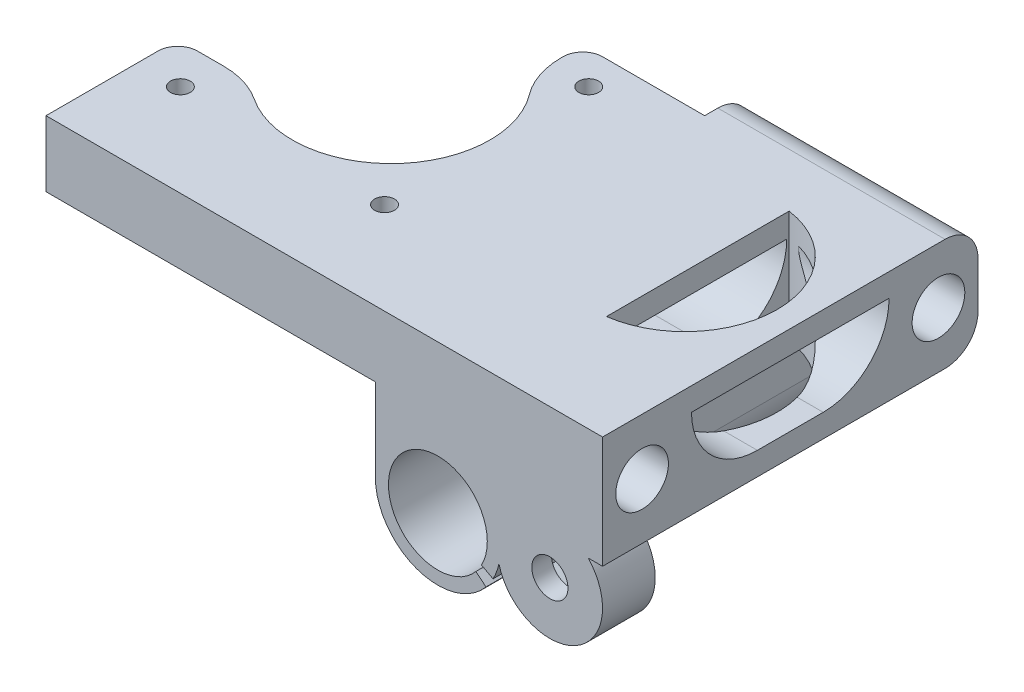
from build123d import *

# Parameters (mm, degrees)
EXTRUDE1_DEPTH  = 57
SKETCH2_R       = 2.75
EXTRUDE2_DEPTH  = 8
EXTRUDE3_DEPTH  = 5
EXTRUDE4_DEPTH  = 50
SKETCH5_R       = 4
EXTRUDE5_DEPTH  = 33
SKETCH6_W       = 30
SKETCH6_H       = 10
EXTRUDE6_DEPTH  = 33
SKETCH7_W       = 50
SKETCH7_H       = 10
EXTRUDE7_DEPTH  = 50
SKETCH10_R      = 1.5
EXTRUDE10_DEPTH = 10
SKETCH11_R      = 2.75
EXTRUDE13_DEPTH = 1
SKETCH12_R      = 15
EXTRUDE14_DEPTH = 10
FILLET2_R       = 5
FILLET3_R       = 5
FILLET4_R       = 10
EXTRUDE15_REACH = 96.553
SKETCH14_W      = 20
SKETCH14_H      = 10
EXTRUDE16_DEPTH = 60
EXTRUDE18_DEPTH = 60
FILLET5_R       = 10
FILLET6_R       = 12
FILLET7_R       = 3
FILLET8_R       = 3
FILLET9_R       = 3


# Some blends are built 0.0001 mm under size
with BuildPart() as part:
    # Sketch1 → Extrude1 (new body)
    with BuildSketch(Plane.XY):
        with BuildLine():
            Line((73.499997202, -17), (73.499997202, 0))
            Line((73.499997202, 0), (39, 0))
            Line((39, 0), (39, -17))
            Line((39, -17), (43.389340395, -17))
            ThreePointArc((43.389340395, -17), (48.49587093, -14.994566191), (53.602401465, -17))
            Line((53.602401465, -17), (73.499997202, -17))
        make_face()
    extrude(amount=-EXTRUDE1_DEPTH)

    # Sketch2 → Extrude2 (add)
    with BuildSketch(Plane.XY):
        with BuildLine():
            Line((57.95839, -23.293955), (57.95839, -17))
            Line((57.95839, -17), (71.309471167, -17))
            ThreePointArc((71.309471167, -17), (69.395977388, -29.48722516), (57.767354943, -24.550891432))
            ThreePointArc((57.767354943, -24.550891432), (57.883931975, -23.925623937), (57.95839, -23.293955))
        make_face()
        with Locations((65.5, -22.5)):
            Circle(SKETCH2_R, mode=Mode.SUBTRACT)
    extrude(amount=-EXTRUDE2_DEPTH)

    # Sketch3 → Extrude3 (cut)
    with BuildSketch(Plane(origin=(0, 0, -8), x_dir=(-1, 0, 0), z_dir=(0, 0, -1))):
        Polygon((-69.5, -20.190598923), (-65.5, -17.881197846), (-61.5, -20.190598923), (-61.5, -24.809401077), (-65.5, -27.118802154), (-69.5, -24.809401077), align=None)
    extrude(amount=-EXTRUDE3_DEPTH, mode=Mode.SUBTRACT)

    # Sketch4 → Extrude4 (add)
    with BuildSketch(Plane.XY):
        with BuildLine():
            Line((39, -17), (39, -22.5))
            ThreePointArc((39, -22.5), (45.271742795, -31.43055539), (55.801591252, -28.564919557))
            Line((55.801591252, -28.564919557), (54.269524764, -27.292339419))
            ThreePointArc((54.269524764, -27.292339419), (43.338902241, -27.950290613), (43.389340395, -17))
            Line((43.389340395, -17), (39, -17))
        make_face()
        with BuildLine():
            Line((56.876362299, -26.964085637), (55.118731957, -26.027376827))
            ThreePointArc((55.118731957, -26.027376827), (55.896414133, -21.25571178), (53.602401465, -17))
            Line((53.602401465, -17), (57.95839, -17))
            Line((57.95839, -17), (57.95839, -23.293955))
            ThreePointArc((57.95839, -23.293955), (57.60414849, -25.184084529), (56.876362299, -26.964085637))
        make_face()
    extrude(amount=-EXTRUDE4_DEPTH)

    # Sketch5 → Extrude5 (cut)
    with BuildSketch(Plane(origin=(73.499997202, 0, 0), x_dir=(0, 0, -1), z_dir=(1, 0, 0))):
        with Locations((6, -8.5)):
            Circle(SKETCH5_R)
        with Locations((51, -8.5)):
            Circle(SKETCH5_R)
    extrude(amount=-EXTRUDE5_DEPTH, mode=Mode.SUBTRACT)

    # Sketch6 → Extrude6 (cut)
    with BuildSketch(Plane(origin=(73.499997202, 0, 0), x_dir=(0, 0, -1), z_dir=(1, 0, 0))):
        with Locations((28.5, -8.5)):
            Rectangle(SKETCH6_W, SKETCH6_H)
    extrude(amount=-EXTRUDE6_DEPTH, mode=Mode.SUBTRACT)

    # Sketch7 → Extrude7 (add)
    with BuildSketch(Plane.ZY.offset(-39)):
        with Locations((-25, -5)):
            Rectangle(SKETCH7_W, SKETCH7_H)
    extrude(amount=EXTRUDE7_DEPTH)

    # Sketch10 → Extrude10 (cut)
    with BuildSketch(Plane.XZ.offset(10)):
        with Locations((-4.599204374, -45)):
            Circle(SKETCH10_R)
        with Locations((26.400795626, -45)):
            Circle(SKETCH10_R)
        with Locations((26.400795626, -14)):
            Circle(SKETCH10_R)
        with Locations((-4.599204374, -14)):
            Circle(SKETCH10_R)
    extrude(amount=-EXTRUDE10_DEPTH, mode=Mode.SUBTRACT)

    # Sketch11 → Extrude13 (cut)
    with BuildSketch(Plane.XZ.offset(10)):
        with Locations((-4.599204374, -14)):
            Circle(SKETCH11_R)
        with Locations((26.400795626, -14)):
            Circle(SKETCH11_R)
        with Locations((26.400795626, -45)):
            Circle(SKETCH11_R)
    extrude(amount=-EXTRUDE13_DEPTH, mode=Mode.SUBTRACT)

    # Sketch12 → Extrude14 (cut)
    with BuildSketch(Plane.XZ.offset(10)):
        with Locations((10.900795626, -30.5)):
            Circle(SKETCH12_R)
    extrude(amount=-EXTRUDE14_DEPTH, mode=Mode.SUBTRACT)

    # Fillet2
    fillet2_edges = [part.edges().sort_by_distance(p)[0] for p in [
        (48.49587093, -14.994566191, -57),
        (63.551199334, -17, -57),
        (41.194670197, -17, -57),
    ]]
    fillet(fillet2_edges, radius=FILLET2_R)

    # Fillet3
    fillet3_edges = [part.edges().sort_by_distance(p)[0] for p in [
        (56.249998601, 0, -57),
    ]]
    fillet(fillet3_edges, radius=FILLET3_R)

    # Fillet4
    fillet4_edges = [part.edges().sort_by_distance(p)[0] for p in [
        (56.999997202, -13.5, -43.5),
    ]]
    fillet(fillet4_edges, radius=FILLET4_R - 0.0001)  # a hair under: the kernel refuses the full size

    # Extrude15: up to this face of the body (flat: up to its plane)
    extrude15_end = Plane(part.part.faces().sort_by_distance((35.938109504, 0, -24.375937497))[0])
    # Sketch13 → Extrude15 (cut, up to the picked face)
    with BuildSketch(Plane.XZ.offset(17), mode=Mode.PRIVATE) as extrude15_sk1:
        with BuildLine():
            Line((57.95839, -16.137451745), (57.95839, -43.862548255))
            ThreePointArc((57.95839, -43.862548255), (69.999997202, -30), (57.95839, -16.137451745))
        make_face()
    extrude15_tool1 = split(extrude(extrude15_sk1.sketch, amount=-EXTRUDE15_REACH, mode=Mode.PRIVATE), bisect_by=extrude15_end, keep=Keep.BOTH, mode=Mode.PRIVATE)
    add(extrude15_tool1.solids().sort_by(Axis((63.013259, -17, -30), (0, 1, 0)))[0], mode=Mode.SUBTRACT)

    # Sketch14 → Extrude16 (cut)
    with BuildSketch(Plane(origin=(40.499997202, 0, 0), x_dir=(0, 0, -1), z_dir=(1, 0, 0))):
        with Locations((30, -8.5)):
            Rectangle(SKETCH14_W, SKETCH14_H)
    extrude(amount=-EXTRUDE16_DEPTH, mode=Mode.SUBTRACT)

    # Sketch15 → Extrude18 (cut)
    with BuildSketch(Plane(origin=(0, 0, 0), x_dir=(1, 0, 0), z_dir=(0, 1, 0))):
        Polygon((2.11392048, 20), (-12.43887347, 20), (-12.43887347, 50), (20.496397049, 50), (20.496397049, 40), (2.11392048, 40), align=None)
    extrude(amount=-EXTRUDE18_DEPTH, mode=Mode.SUBTRACT)

    # Fillet5
    # the kernel refuses this fillet: 10 mm, written as the material it adds along each edge
    with BuildSketch(Plane(origin=(73.499997202, -13.5, -13.5), x_dir=(0, 1, 0), z_dir=(-1, 0, 0))) as fillet5_piece_1_section:
        with BuildLine():
            CenterArc((FILLET5_R, FILLET5_R), FILLET5_R, 180, 90)
            Line((0, FILLET5_R), (0, 0))
            Line((0, 0), (FILLET5_R, 0))
        make_face()
    fillet5_piece_1 = extrude(amount=33, mode=Mode.PRIVATE)
    fillet5_piece_1 = split(fillet5_piece_1, bisect_by=Plane(origin=(57.95839, -11.020059701, -15.351239597), z_dir=(1, 0, 0)), keep=Keep.TOP, mode=Mode.PRIVATE)
    fillet5_piece_1 = fillet5_piece_1 - Plane(origin=(55.999766898, -11.020059701, -30), x_dir=(0.13989934874108464, 0, -0.9901657296744927), z_dir=(0, -1, 0)) * Cylinder(14.000230304, 106, mode=Mode.PRIVATE)
    add(fillet5_piece_1)
    with BuildSketch(Plane(origin=(73.499997202, -13.5, -13.5), x_dir=(0, 1, 0), z_dir=(-1, 0, 0))) as fillet5_piece_2_section:
        with BuildLine():
            CenterArc((FILLET5_R, FILLET5_R), FILLET5_R, 180, 90)
            Line((0, FILLET5_R), (0, 0))
            Line((0, 0), (FILLET5_R, 0))
        make_face()
    fillet5_piece_2 = extrude(amount=33, mode=Mode.PRIVATE)
    fillet5_piece_2 = split(fillet5_piece_2, bisect_by=Plane(origin=(57.95839, -10.883667804, -15.13209824), z_dir=(-1, 0, 0)), keep=Keep.TOP, mode=Mode.PRIVATE)
    fillet5_piece_2 = fillet5_piece_2 - Plane(origin=(55.999766898, -10.883667804, -30), x_dir=(0.13989934874108464, 0, -0.9901657296744927), z_dir=(0, -1, 0)) * Cylinder(14.000230304, 106, mode=Mode.PRIVATE)
    add(fillet5_piece_2)
    with BuildSketch(Plane(origin=(73.499997202, -13.5, -13.5), x_dir=(0, 1, 0), z_dir=(-1, 0, 0))) as fillet5_piece_3_section:
        with BuildLine():
            CenterArc((FILLET5_R, FILLET5_R), FILLET5_R, 180, 90)
            Line((0, FILLET5_R), (0, 0))
            Line((0, 0), (FILLET5_R, 0))
        make_face()
    fillet5_piece_3 = extrude(amount=33, mode=Mode.PRIVATE)
    fillet5_piece_3 = split(fillet5_piece_3, bisect_by=Plane(origin=(57.95839, -12.859707332, -18.675298705), z_dir=(-1, 0, 0)), keep=Keep.TOP, mode=Mode.PRIVATE)
    fillet5_piece_3 = fillet5_piece_3 & Plane(origin=(55.999766898, -12.859707332, -30), x_dir=(0.13989934874108464, 0, -0.9901657296744927), z_dir=(0, -1, 0)) * Cylinder(14.000230304, 106, mode=Mode.PRIVATE)
    add(fillet5_piece_3)
    with BuildSketch(Plane(origin=(73.499997202, -13.5, -13.5), x_dir=(0, 1, 0), z_dir=(-1, 0, 0))) as fillet5_piece_4_section:
        with BuildLine():
            CenterArc((FILLET5_R, FILLET5_R), FILLET5_R, 180, 90)
            Line((0, FILLET5_R), (0, 0))
            Line((0, 0), (FILLET5_R, 0))
        make_face()
    fillet5_piece_4 = extrude(amount=58, mode=Mode.PRIVATE)
    fillet5_piece_4 = split(fillet5_piece_4, bisect_by=Plane(origin=(40.499997202, -11.236048857, -15.763951143), z_dir=(-1, 0, 0)), keep=Keep.TOP, mode=Mode.PRIVATE)
    fillet5_piece_4 = split(fillet5_piece_4, bisect_by=Plane(origin=(39, -11.236048857, -15.763951143), z_dir=(1, 0, 0)), keep=Keep.TOP, mode=Mode.PRIVATE)
    add(fillet5_piece_4)

    # Fillet6
    fillet6_edges = [part.edges().sort_by_distance(p)[0] for p in [
        (0.188652983, -5, -20),
        (20.496397049, -5, -42.029285899),
    ]]
    fillet(fillet6_edges, radius=FILLET6_R)

    # Fillet7
    # the kernel refuses this fillet: 3 mm, written as the material it takes off along each edge
    with BuildSketch(Plane(origin=(40.499997202, -18.59939602, -40), x_dir=(-1, 0, 0), z_dir=(0, 1, 0))) as fillet7_piece_1_section:
        with BuildLine():
            CenterArc((FILLET7_R, -FILLET7_R), FILLET7_R, 90, 90)
            Line((0, -FILLET7_R), (0, 0))
            Line((0, 0), (FILLET7_R, 0))
        make_face()
    fillet7_piece_1 = extrude(amount=15.09939602, mode=Mode.PRIVATE)
    fillet7_piece_1 = split(fillet7_piece_1, bisect_by=Plane(origin=(39.991722384, -13.5, -40.797398057), z_dir=(0, 1, 0)), keep=Keep.TOP, mode=Mode.PRIVATE)
    add(fillet7_piece_1, mode=Mode.SUBTRACT)
    with BuildSketch(Plane(origin=(40.499997202, -3.5, -20), x_dir=(-1, 0, 0), z_dir=(0, -1, 0))) as fillet7_piece_2_section:
        with BuildLine():
            CenterArc((FILLET7_R, -FILLET7_R), FILLET7_R, 90, 90)
            Line((0, -FILLET7_R), (0, 0))
            Line((0, 0), (FILLET7_R, 0))
        make_face()
    fillet7_piece_2 = extrude(amount=16.867496998, mode=Mode.PRIVATE)
    fillet7_piece_2 = fillet7_piece_2 & Plane(origin=(38.630208494, -3.5, -23.5), x_dir=(0, 1, 0), z_dir=(1, 0, 0)) * Cylinder(10, 46, mode=Mode.PRIVATE)
    add(fillet7_piece_2, mode=Mode.SUBTRACT)

    # Fillet8
    fillet8_edges = [part.edges().sort_by_distance(p)[0] for p in [
        (-11, -5, -20),
    ]]
    fillet(fillet8_edges, radius=FILLET8_R)

    # Fillet9
    fillet9_edges = [part.edges().sort_by_distance(p)[0] for p in [
        (20.496397049, -5, -50),
    ]]
    fillet(fillet9_edges, radius=FILLET9_R)


solid = part.part
